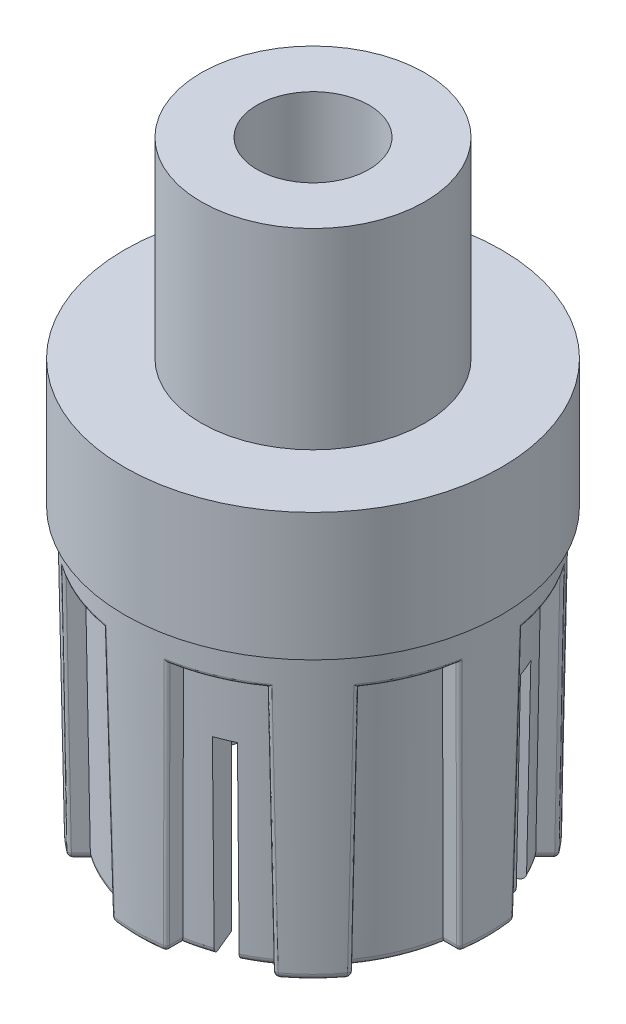
from build123d import *

# Parameters (mm, degrees)
SKETCH_1_R          = 5.5
EXTRUDE_1_DEPTH     = 9
EXTRUDE_1_DRAFT     = -1
SKETCH_2_R          = 5.9
EXTRUDE_2_DEPTH     = 4
SKETCH_4_R          = 3.5
EXTRUDE_4_DEPTH     = 6
SKETCH_6_R          = 6.612038837
CUT_EXTRUDE_1_DEPTH = 8
CUT_EXTRUDE_1_DRAFT = -1
FILLET_2_R          = 0.2
FILLET_4_R          = 0.1
SKETCH_7_R          = 1.75
CUT_EXTRUDE_2_DEPTH = 21.751385496
SKETCH_8_R          = 4
CUT_EXTRUDE_3_DEPTH = 7
CUT_EXTRUDE_4_DEPTH = 6


with BuildPart() as part:
    # Эскиз1 → Бобышка-Вытянуть1 (with draft: the straight prism first)
    with BuildSketch(Plane(origin=(0, 0, 0), x_dir=(1, 0, 0), z_dir=(0, 1, 0))):
        Circle(SKETCH_1_R)
    extrude(amount=EXTRUDE_1_DEPTH)
    # Бобышка-Вытянуть1: the draft: its side faces are tilted about the plane it starts from
    extrude_1_sides = [part.faces().sort_by_distance(p)[0] for p in [
        (-5.5, 4.5, 0),
    ]]
    draft(extrude_1_sides, Plane(origin=(0, 0, 0), x_dir=(1, 0, 0), z_dir=(0, 1, 0)), EXTRUDE_1_DRAFT)

    # Эскиз2 → Бобышка-Вытянуть2 (add)
    with BuildSketch(Plane(origin=(0, 9, 0), x_dir=(1, 0, 0), z_dir=(0, 1, 0))):
        Circle(SKETCH_2_R)
    extrude(amount=EXTRUDE_2_DEPTH)

    # Эскиз4 → Бобышка-Вытянуть4 (add)
    with BuildSketch(Plane(origin=(0, 13, 0), x_dir=(1, 0, 0), z_dir=(0, 1, 0))):
        Circle(SKETCH_4_R)
    extrude(amount=EXTRUDE_4_DEPTH)


with BuildPart() as cut_extrude_1_tool:
    # Эскиз6 → Вырез-Вытянуть1 (with draft: the straight prism first)
    with BuildSketch(Plane.XZ):
        Circle(SKETCH_6_R)
        with BuildLine():
            Line((-0.85, 5.707048274), (-0.85, 4.927220312))
            ThreePointArc((-0.85, 4.927220312), (-1.911392621, 4.620235735), (-2.879448589, 4.087636948))
            Line((-2.879448589, 4.087636948), (-3.430942403, 4.639130762))
            ThreePointArc((-3.430942403, 4.639130762), (-4.076917863, 4.083092056), (-4.633933474, 3.437958778))
            Line((-4.633933474, 3.437958778), (-4.082583614, 2.886608917))
            ThreePointArc((-4.082583614, 2.886608917), (-4.616878122, 1.91948858), (-4.925722647, 0.858636364))
            Line((-4.925722647, 0.858636364), (-5.705755305, 0.858636364))
            ThreePointArc((-5.705755305, 0.858636364), (-5.769993393, 0.008731627), (-5.708327884, -0.841363636))
            Line((-5.708327884, -0.841363636), (-4.928702388, -0.841363636))
            ThreePointArc((-4.928702388, -0.841363636), (-4.623090246, -1.904478033), (-4.091203541, -2.874378818))
            Line((-4.091203541, -2.874378818), (-4.642800097, -3.425975374))
            ThreePointArc((-4.642800097, -3.425975374), (-4.087452231, -4.07254641), (-3.442914404, -4.630252737))
            Line((-3.442914404, -4.630252737), (-2.891665383, -4.079003716))
            ThreePointArc((-2.891665383, -4.079003716), (-1.922348573, -4.615688027), (-0.858636364, -4.925722647))
            Line((-0.858636364, -4.925722647), (-0.858636364, -5.705755305))
            ThreePointArc((-0.858636364, -5.705755305), (-0.008731627, -5.769993393), (0.841363636, -5.708327884))
            Line((0.841363636, -5.708327884), (0.841363636, -4.928702388))
            ThreePointArc((0.841363636, -4.928702388), (1.907343355, -4.62190884), (2.879448589, -4.087636948))
            Line((2.879448589, -4.087636948), (3.430942403, -4.639130762))
            ThreePointArc((3.430942403, -4.639130762), (4.076917863, -4.083092056), (4.633933474, -3.437958778))
            Line((4.633933474, -3.437958778), (4.082583614, -2.886608917))
            ThreePointArc((4.082583614, -2.886608917), (4.61855883, -1.915441029), (4.927220312, -0.85))
            Line((4.927220312, -0.85), (5.707048274, -0.85))
            ThreePointArc((5.707048274, -0.85), (5.77, 0), (5.707048274, 0.85))
            Line((5.707048274, 0.85), (4.927220312, 0.85))
            ThreePointArc((4.927220312, 0.85), (4.619050299, 1.914255557), (4.084064842, 2.884512847))
            Line((4.084064842, 2.884512847), (4.635456703, 3.435904707))
            ThreePointArc((4.635456703, 3.435904707), (4.07872721, 4.081284644), (3.43299843, 4.63760949))
            Line((3.43299843, 4.63760949), (2.881546942, 4.086158002))
            ThreePointArc((2.881546942, 4.086158002), (1.912578651, 4.619744896), (0.85, 4.927220312))
            Line((0.85, 4.927220312), (0.85, 5.707048274))
            ThreePointArc((0.85, 5.707048274), (0, 5.77), (-0.85, 5.707048274))
        make_face(mode=Mode.SUBTRACT)
    extrude(amount=-CUT_EXTRUDE_1_DEPTH)
    # Вырез-Вытянуть1: the draft: its side faces are tilted about the plane it starts from
    cut_extrude_1_sides = [cut_extrude_1_tool.faces().sort_by_distance(p)[0] for p in [
        (-6.612038837, 4, 0),
        (4.07872721, 4, 4.081284644),
        (4.359760773, 4, 3.160208777),
        (4.619050299, 4, 1.914255557),
        (5.317134293, 4, 0.85),
        (5.77, 4, 0),
        (5.317134293, 4, -0.85),
        (4.61855883, 4, -1.915441029),
        (4.358258544, 4, -3.162283847),
        (4.076917863, 4, -4.083092056),
        (3.155195496, 4, -4.363383855),
        (1.907343355, 4, -4.62190884),
        (0.841363636, 4, -5.318515136),
        (-0.008731627, 4, -5.769993393),
        (-0.858636364, 4, -5.315738976),
        (-1.922348573, 4, -4.615688027),
        (-3.167289893, 4, -4.354628226),
        (-4.087452231, 4, -4.07254641),
        (-4.367001819, 4, -3.150177096),
        (-4.623090246, 4, -1.904478033),
        (-5.318515136, 4, -0.841363636),
        (-5.769993393, 4, 0.008731627),
        (-5.315738976, 4, 0.858636364),
        (-4.616878122, 4, 1.91948858),
        (-4.358258544, 4, 3.162283847),
        (-4.076917863, 4, 4.083092056),
        (-3.155195496, 4, 4.363383855),
        (-1.911392621, 4, 4.620235735),
        (-0.85, 4, 5.317134293),
        (0, 4, 5.77),
        (0.85, 4, 5.317134293),
        (1.912578651, 4, 4.619744896),
        (3.157272686, 4, 4.361883746),
    ]]
    draft(cut_extrude_1_sides, Plane.XZ, CUT_EXTRUDE_1_DRAFT)


with BuildPart() as part_1:
    add(part.part)

    # Вырез-Вытянуть1: cut by cut_extrude_1_tool
    add(cut_extrude_1_tool.part, mode=Mode.SUBTRACT)

    # Скругление2
    fillet_2_edges = [part_1.edges().sort_by_distance(p)[0] for p in [
        (1.912578651, 0, 4.619744896),
        (3.060702956, 0, 4.265314017),
        (3.88780694, 0, 3.890367232),
        (4.263200511, 0, 3.063648515),
        (4.619050299, 0, 1.914255557),
        (5.180570774, 0, 0.85),
        (5.483455425, 0, 0.426282302),
        (5.180570774, 0, -0.85),
        (4.61855883, 0, -1.915441029),
        (4.261704952, 0, -3.065730255),
        (3.885995522, 0, -3.892176615),
        (3.058619045, 0, -4.266807405),
        (1.907343355, 0, -4.62190884),
        (0.841363636, 0, -5.181983768),
        (-0.008741386, 0, -5.499993053),
        (-0.858636364, 0, -5.179142954),
        (-1.922348573, 0, -4.615688027),
        (-3.070752315, 0, -4.258090648),
        (-3.896541379, 0, -3.8816189),
        (-4.270409055, 0, -3.053584332),
        (-4.623090246, 0, -1.904478033),
        (-5.181983768, 0, -0.841363636),
        (-5.499993053, 0, 0.008741386),
        (-5.179142954, 0, 0.858636364),
        (-4.616878122, 0, 1.91948858),
        (-4.261704952, 0, 3.065730255),
        (-3.885995522, 0, 3.892176615),
        (-3.058619045, 0, 4.266807405),
        (-1.911392621, 0, 4.620235735),
        (-0.85, 0, 5.180570774),
        (0, 0, 5.5),
        (0.85, 0, 5.180570774),
    ]]
    fillet(fillet_2_edges, radius=FILLET_2_R)

    # Скругление4
    fillet_4_edges = [part_1.edges().sort_by_distance(p)[0] for p in [
        (0.783582369, 0.048117432, 5.376784924),
        (-0.783582369, 0.048117432, 5.376784924),
        (-3.244383835, 0.048127982, 4.358660894),
        (-4.353411556, 0.048106878, 3.251382997),
        (-5.375540481, 0.048138528, 0.792243353),
        (-5.378015108, 0.048096321, -0.77492136),
        (-4.362366645, 0.048142899, -3.239428604),
        (-3.256326079, 0.048091944, -4.349693616),
        (-0.792243352, 0.048138527, -5.375540481),
        (0.774921357, 0.048096319, -5.378015107),
        (3.244383835, 0.048127982, -4.358660894),
        (4.353411561, 0.048106881, -3.251382996),
        (5.376784924, 0.048117432, -0.783582369),
        (5.376784924, 0.048117432, 0.783582369),
        (4.354950098, 0.048113061, 3.249334032),
        (3.246434884, 0.048121802, 4.357124445),
        (2.157357668, 8, 5.210696027),
        (0.921535225, 4.098250296, 5.494795501),
        (-0.921535225, 4.098250296, 5.494795501),
        (-2.156170508, 8, 5.211187382),
        (-3.230216614, 4.098250306, 4.539571058),
        (-4.534488407, 4.098250286, 3.237347625),
        (-5.207826912, 8, 2.164274484),
        (-5.493340112, 4.098250316, 0.930171589),
        (-5.496236933, 4.098250276, -0.912898861),
        (-5.214045599, 8, -2.149249563),
        (-4.543159078, 4.09825032, -3.225168269),
        (-3.242384058, 4.098250271, -4.530888476),
        (-2.167137546, 8, -5.206636154),
        (-0.930171589, 4.098250316, -5.493340112),
        (0.912898861, 4.098250276, -5.496236933),
        (2.152117404, 8, -5.212862541),
        (3.230216614, 4.098250306, -4.539571058),
        (4.534488407, 4.098250286, -3.237347625),
        (5.20950884, 8, -2.160222868),
        (5.494795501, 4.098250296, -0.921535225),
        (5.494795501, 4.098250296, 0.921535225),
        (5.210000751, 8, 2.15903621),
        (4.535978103, 4.098250292, 3.235260022),
        (3.23230626, 4.0982503, 4.538083406),
        (-5.657095584, 9, 0),
    ]]
    fillet(fillet_4_edges, radius=FILLET_4_R)

    # Эскиз7 → Вырез-Вытянуть2 (cut, through all)
    with BuildSketch(Plane.XZ):
        Circle(SKETCH_7_R)
    extrude(amount=-CUT_EXTRUDE_2_DEPTH, mode=Mode.SUBTRACT)

    # Эскиз8 → Вырез-Вытянуть3 (cut)
    with BuildSketch(Plane.XZ):
        Circle(SKETCH_8_R)
    extrude(amount=-CUT_EXTRUDE_3_DEPTH, mode=Mode.SUBTRACT)

    # Эскиз9 → Вырез-Вытянуть4 (cut)
    with BuildSketch(Plane.XZ):
        Polygon((-6.419845563, 2.335744913), (-0.391517942, -0.161270146), (-2.880463226, -6.170115607), (-2.326135507, -6.399725667), (0.162809778, -0.390880205), (5.944023446, -2.785537313), (6.173182557, -2.232298278), (0.391968889, 0.16235883), (2.816151439, 6.014853219), (2.26182372, 6.244463279), (-0.16235883, 0.391968889), (-6.190686451, 2.888983949), align=None)
    extrude(amount=-CUT_EXTRUDE_4_DEPTH, mode=Mode.SUBTRACT)


solid = part_1.part
